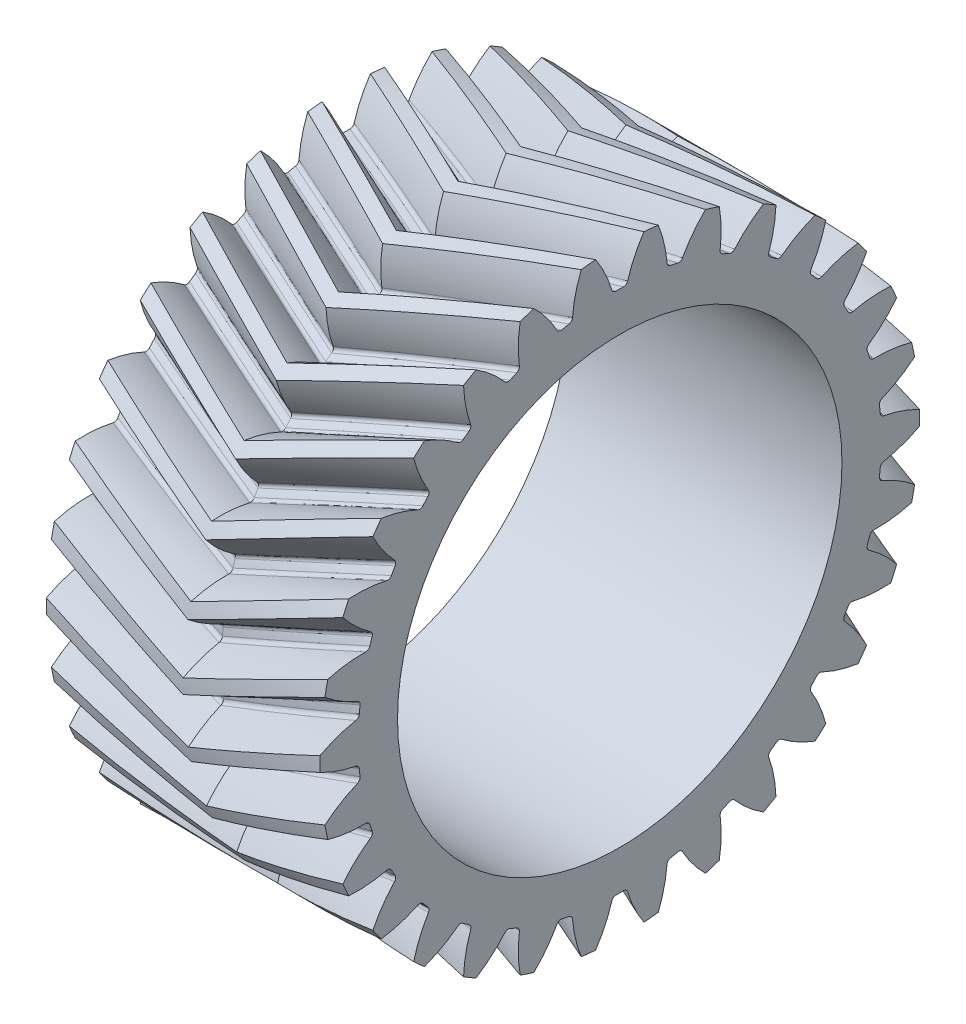
from build123d import *

# Parameters (mm, degrees)
BASPROSKE_W            = 8
BASPROSKE_H            = 17.550668784
TOOTHCUTRH_PITCH       = 236.48357969
TOOTHCUTRH_HEIGHT      = 8
TOOTHCUTRH_RADIUS      = 17.550668784
TOOTHCUTRH_START_ANGLE = -90
TEETHCUTSRH_COUNT      = 30
TEETHCUTSRH_ANGLE      = 348
BORSKE_R               = 13
BORE_DEPTH             = 62.5000025


with BuildPart() as part:
    # BasProSke → Base-Revolve (revolve)
    with BuildSketch(Plane(origin=(0, 0, 0), x_dir=(1, 0, 0), z_dir=(0, 1, 0)), mode=Mode.PRIVATE) as base_revolve_sk:
        with Locations((4, 8.775334392)):
            Rectangle(BASPROSKE_W, BASPROSKE_H)
    revolve(base_revolve_sk.sketch.rotate(Axis((-10, 0, 0), (1, 0, 0)), 180), axis=Axis((-10, 0, 0), (1, 0, 0)))

    # ToothCutRH: sweep along a helix
    with BuildLine() as toothcutrh_path:
        add(Helix(TOOTHCUTRH_PITCH, TOOTHCUTRH_HEIGHT, TOOTHCUTRH_RADIUS, center=(0, 0, 0), direction=(1, 0, 0), mode=Mode.PRIVATE).rotate(Axis((0, 0, 0), (1, 0, 0)), TOOTHCUTRH_START_ANGLE))
    # TooCutSkeRH → ToothCutRH (sweep, cut)
    with BuildSketch(Plane(origin=(0, 0, 0), x_dir=(0, 0, -1), z_dir=(1, 0, 0))):
        with BuildLine():
            ThreePointArc((0.218307499, 15.299111317), (0, 15.300668784), (-0.218307499, 15.299111317))
            ThreePointArc((-0.218307499, 15.299111317), (-0.370243768, 15.347621495), (-0.462278832, 15.477880522))
            ThreePointArc((-0.462278832, 15.477880522), (-0.999437111, 16.796438687), (-1.776096862, 17.989725862))
            ThreePointArc((-1.776096862, 17.989725862), (0, 18.077188848), (1.776096862, 17.989725862))
            ThreePointArc((1.776096862, 17.989725862), (0.999437111, 16.796438687), (0.462278832, 15.477880522))
            ThreePointArc((0.462278832, 15.477880522), (0.370243768, 15.347621495), (0.218307499, 15.299111317))
        make_face()
    toothcutrh = sweep(path=toothcutrh_path.line, is_frenet=True, mode=Mode.SUBTRACT)

    # TeethCutsRH: ToothCutRH ×30 about axis
    teethcutsrh_axis = Axis((-10, 0, 0), (1, 0, 0))
    for i in range(1, TEETHCUTSRH_COUNT):
        add(toothcutrh.rotate(teethcutsrh_axis, i * TEETHCUTSRH_ANGLE / (TEETHCUTSRH_COUNT - 1)), mode=Mode.SUBTRACT)

    # BorSke → Bore (cut, symmetric)
    with BuildSketch(Plane(origin=(0, 0, 0), x_dir=(0, 0, -1), z_dir=(1, 0, 0))):
        with Locations(Location((0, 0, 0), (0, 0, 180))):
            Circle(BORSKE_R)
    extrude(amount=BORE_DEPTH, both=True, mode=Mode.SUBTRACT)

    # Mirror1: part across plane


with BuildPart() as part_1:
    add(part.part)
    add(part.part.mirror(Plane.ZY.offset(-8)))


solid = part_1.part
